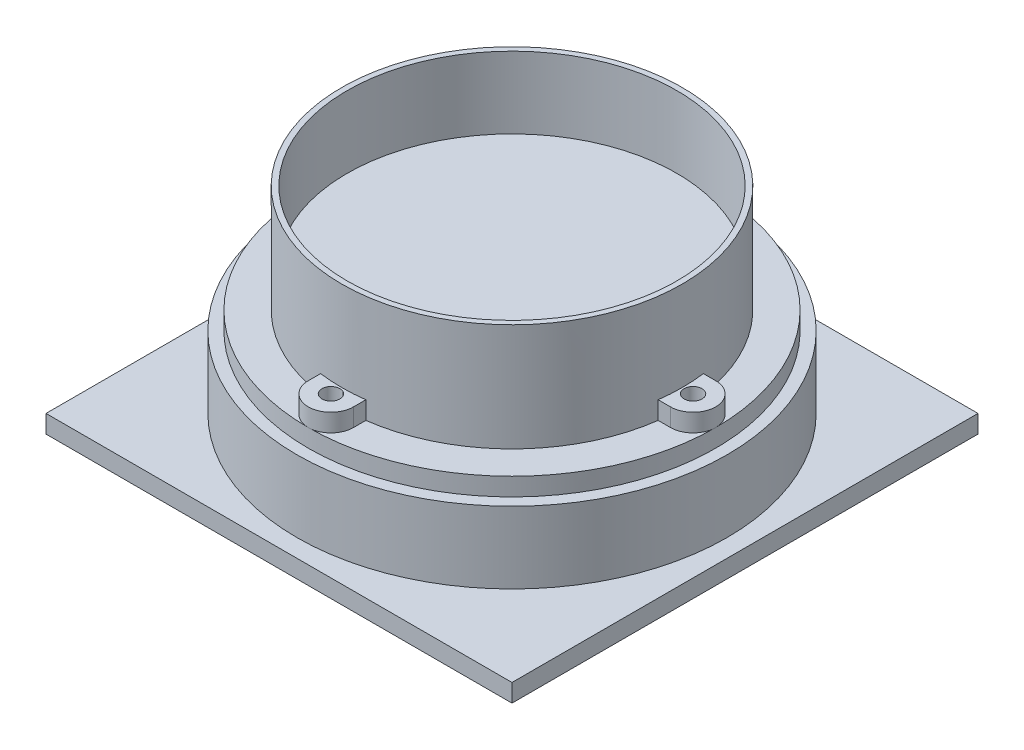
from build123d import *
from build123d.topology import SkipClean

# Parameters (mm, degrees)
SKETCH1_R           = 120.65
BOSS_EXTRUDE1_DEPTH = 63.5
SKETCH2_R           = 116.84
CUT_EXTRUDE1_DEPTH  = 50.8
BOSS_EXTRUDE3_START = 12.7
BOSS_EXTRUDE3_DEPTH = 12.7
SKETCH5_R           = 144.351080184
BOSS_EXTRUDE4_DEPTH = 12.7
SKETCH6_R           = 152.4
BOSS_EXTRUDE5_DEPTH = 50.8
SKETCH8_W           = 330.2
SKETCH8_H           = 330.2
BOSS_EXTRUDE6_DEPTH = 12.7
SKETCH7_R           = 6.35
CUT_EXTRUDE2_DEPTH  = 250.838407776


with BuildPart() as part:
    # Sketch1 → Boss-Extrude1 (new body)
    with BuildSketch(Plane(origin=(0, 0, 0), x_dir=(1, 0, 0), z_dir=(0, 1, 0))):
        Circle(SKETCH1_R)
    extrude(amount=BOSS_EXTRUDE1_DEPTH)

    # Sketch2 → Cut-Extrude1 (cut)
    with BuildSketch(Plane(origin=(0, 63.5, 0), x_dir=(1, 0, 0), z_dir=(0, 1, 0))):
        Circle(SKETCH2_R)
    extrude(amount=-CUT_EXTRUDE1_DEPTH, mode=Mode.SUBTRACT)

    # Sketch4 → Boss-Extrude3 (add)
    with SkipClean():  # the faces are left unmerged after this step: merging them gives an invalid solid
        with BuildSketch(Plane.XZ.offset(BOSS_EXTRUDE3_START)):
            with BuildLine():
                Line((-16.026299781, 128.324780403), (-16.026299781, 119.58085221))
                ThreePointArc((-16.026299781, 119.58085221), (-85.31243315, 85.31243315), (-119.58085221, 16.026299781))
                Line((-119.58085221, 16.026299781), (-128.324780403, 16.026299781))
                ThreePointArc((-128.324780403, 16.026299781), (-144.351080184, 0), (-128.324780403, -16.026299781))
                Line((-128.324780403, -16.026299781), (-119.58085221, -16.026299781))
                ThreePointArc((-119.58085221, -16.026299781), (-85.31243315, -85.31243315), (-16.026299781, -119.58085221))
                Line((-16.026299781, -119.58085221), (-16.026299781, -128.324780403))
                ThreePointArc((-16.026299781, -128.324780403), (0, -144.351080184), (16.026299781, -128.324780403))
                Line((16.026299781, -128.324780403), (16.026299781, -119.58085221))
                ThreePointArc((16.026299781, -119.58085221), (85.31243315, -85.31243315), (119.58085221, -16.026299781))
                Line((119.58085221, -16.026299781), (128.324780403, -16.026299781))
                ThreePointArc((128.324780403, -16.026299781), (144.351080184, 0), (128.324780403, 16.026299781))
                Line((128.324780403, 16.026299781), (119.58085221, 16.026299781))
                ThreePointArc((119.58085221, 16.026299781), (85.31243315, 85.31243315), (16.026299781, 119.58085221))
                Line((16.026299781, 119.58085221), (16.026299781, 128.324780403))
                ThreePointArc((16.026299781, 128.324780403), (0, 144.351080184), (-16.026299781, 128.324780403))
            make_face()
        extrude(amount=-BOSS_EXTRUDE3_DEPTH)

    # Sketch5 → Boss-Extrude4 (add)
    with SkipClean():  # the faces are left unmerged after this step: merging them gives an invalid solid
        with BuildSketch(Plane.XZ.offset(12.7)):
            Circle(SKETCH5_R)
        extrude(amount=BOSS_EXTRUDE4_DEPTH)

    # Sketch6 → Boss-Extrude5 (add)
    with BuildSketch(Plane.XZ.offset(25.4)):
        Circle(SKETCH6_R)
    extrude(amount=BOSS_EXTRUDE5_DEPTH)

    # Sketch8 → Boss-Extrude6 (add)
    with BuildSketch(Plane.XZ.offset(76.2)):
        Rectangle(SKETCH8_W, SKETCH8_H)
    extrude(amount=BOSS_EXTRUDE6_DEPTH)

    # Sketch7 → Cut-Extrude2 (cut, through all)
    with SkipClean():  # the faces are left unmerged after this step: merging them gives an invalid solid
        with BuildSketch(Plane(origin=(0, 0, 0), x_dir=(1, 0, 0), z_dir=(0, 1, 0))):
            with Locations((0, 128.324780403)):
                Circle(SKETCH7_R)
            with Locations((-128.324780403, 0)):
                Circle(SKETCH7_R)
            with Locations((0, -128.324780403)):
                Circle(SKETCH7_R)
            with Locations((128.324780403, 0)):
                Circle(SKETCH7_R)
        extrude(amount=-CUT_EXTRUDE2_DEPTH, mode=Mode.SUBTRACT)


solid = part.part
